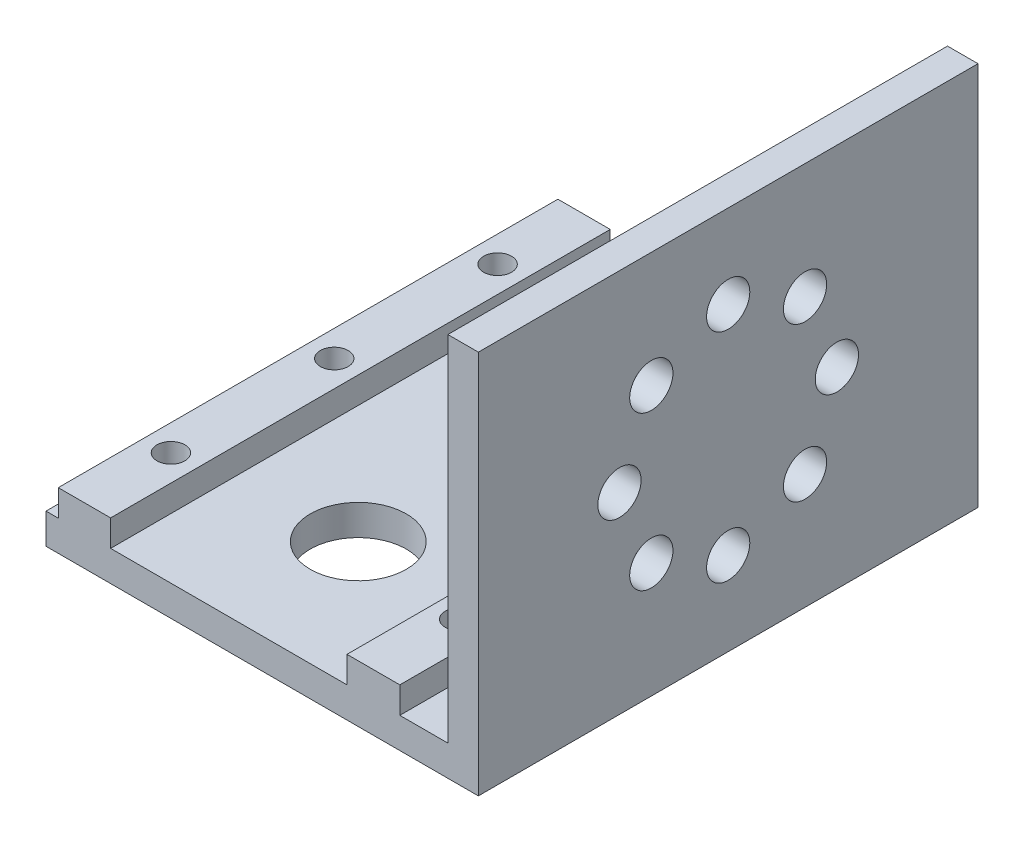
from build123d import *

# Parameters (mm, degrees)
BOSS_EXTRUDE1_DEPTH    = 52
SKETCH3_R              = 5
CUT_EXTRUDE2_DEPTH     = 78.803153053
M2_5_CLEARANCE_HOLE1_D = 2.9
M4_CLEARANCE_HOLE1_D   = 4.5


with BuildPart() as part:
    # Sketch1 → Boss-Extrude1 (new body)
    with BuildSketch(Plane.XY):
        Polygon((0, 0), (0, 36.825), (3.175, 36.825), (3.175, -3.175), (-41.825, -3.175), (-41.825, 0), (-40.55, 0), (-40.55, 2.75), (-35.1, 2.75), (-35.1, 0), (-10.5, 0), (-10.5, 2.75), (-5, 2.75), (-5, 0), align=None)
    extrude(amount=BOSS_EXTRUDE1_DEPTH)

    # Sketch3 → Cut-Extrude2 (cut, through all)
    with BuildSketch(Plane(origin=(0, -3.175, 0), x_dir=(-1, 0, 0), z_dir=(0, -1, 0))):
        with Locations((22.825, -38.5)):
            Circle(SKETCH3_R)
    extrude(amount=-CUT_EXTRUDE2_DEPTH, mode=Mode.SUBTRACT)

    # M2.5 Clearance Hole1 (through all)
    with Locations(Plane(origin=(0, -3.175, 0), x_dir=(-1, 0, 0), z_dir=(0, -1, 0))):
        with Locations((7.825, -9), (37.825, -9), (7.825, -26), (37.825, -26), (37.825, -43), (7.825, -43)):
            Hole(M2_5_CLEARANCE_HOLE1_D / 2)

    # M4 Clearance Hole1 (through all)
    with Locations(Plane(origin=(3.175, 0, 0), x_dir=(0, 0, -1), z_dir=(1, 0, 0))):
        with Locations((-26, 28.138708499), (-18, 24.825), (-14.686291501, 16.825), (-18, 8.825), (-26, 5.511291501), (-34, 8.825), (-37.313708499, 16.825), (-34, 24.825)):
            Hole(M4_CLEARANCE_HOLE1_D / 2)


solid = part.part
